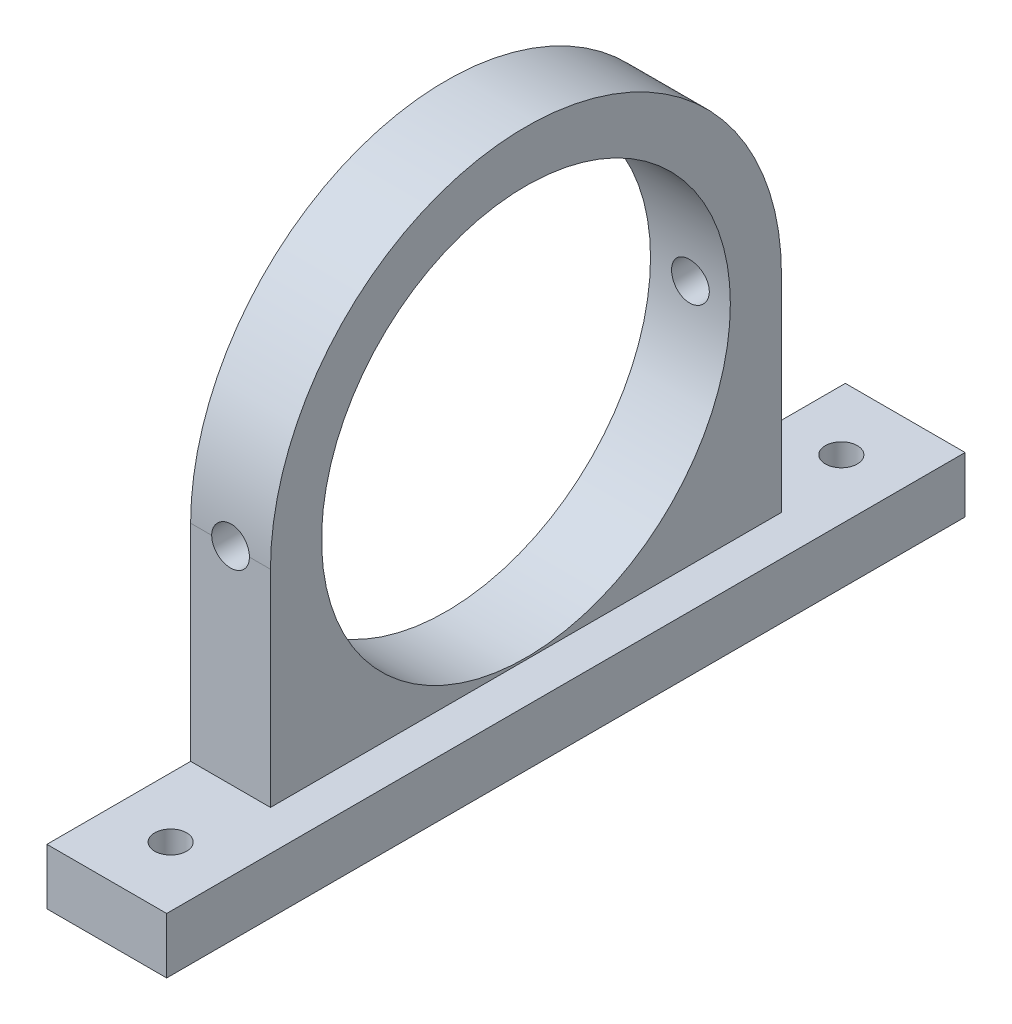
from build123d import *

# Parameters (mm, degrees)
SKETCH2_R                                         = 16.256
BOSS_EXTRUDE1_DEPTH                               = 3.175
SKETCH3_W                                         = 63.5
SKETCH3_H                                         = 4.445
BOSS_EXTRUDE2_DEPTH                               = 3.175
CSK_FOR_0_FLAT_HEAD_MACHINE_SCREW_100_D           = 3.000000096
CSK_FOR_0_FLAT_HEAD_MACHINE_SCREW_100_CSINK_D     = 3.0226
CSK_FOR_0_FLAT_HEAD_MACHINE_SCREW_100_CSINK_ANGLE = 100
SKETCH6_R                                         = 1.27
CUT_EXTRUDE1_DEPTH                                = 6.35


with BuildPart() as part:
    # Sketch2 → Boss-Extrude1 (new, symmetric)
    with BuildSketch(Plane(origin=(0, 0, 0), x_dir=(0, 0, -1), z_dir=(1, 0, 0))):
        with BuildLine():
            Line((-31.75, 0), (31.75, 0))
            Line((31.75, 0), (31.75, 4.445))
            Line((31.75, 4.445), (20.32, 4.445))
            Line((20.32, 4.445), (20.32, 20.85))
            ThreePointArc((20.32, 20.85), (0, 41.17), (-20.32, 20.85))
            Line((-20.32, 20.85), (-20.32, 4.445))
            Line((-20.32, 4.445), (-31.75, 4.445))
            Line((-31.75, 4.445), (-31.75, 0))
        make_face()
        with Locations((0, 20.85)):
            Circle(SKETCH2_R, mode=Mode.SUBTRACT)
    extrude(amount=BOSS_EXTRUDE1_DEPTH, both=True)

    # Sketch3 → Boss-Extrude2 (add)
    with BuildSketch(Plane(origin=(3.175, 0, 0), x_dir=(0, 0, -1), z_dir=(1, 0, 0))):
        with Locations((0, 2.2225)):
            Rectangle(SKETCH3_W, SKETCH3_H)
    extrude(amount=BOSS_EXTRUDE2_DEPTH)

    # CSK for #0 Flat Head Machine Screw (100)1 (through all)
    with Locations(Plane(origin=(0, 0, -20.32), x_dir=(-1, 0, 0), z_dir=(0, 0, -1))):
        with Locations((0, 20.85)):
            CounterSinkHole(CSK_FOR_0_FLAT_HEAD_MACHINE_SCREW_100_D / 2, CSK_FOR_0_FLAT_HEAD_MACHINE_SCREW_100_CSINK_D / 2, counter_sink_angle=CSK_FOR_0_FLAT_HEAD_MACHINE_SCREW_100_CSINK_ANGLE)

    # Sketch6 → Cut-Extrude1 (cut)
    with BuildSketch(Plane(origin=(0, 4.445, 0), x_dir=(1, 0, 0), z_dir=(0, 1, 0))):
        with Locations((1.5875, -26.67)):
            Circle(SKETCH6_R)
    cut_extrude1 = extrude(amount=-CUT_EXTRUDE1_DEPTH, mode=Mode.SUBTRACT)

    # Mirror2: Cut-Extrude1 across plane
    add(cut_extrude1.mirror(Plane.XY), mode=Mode.SUBTRACT)


solid = part.part
